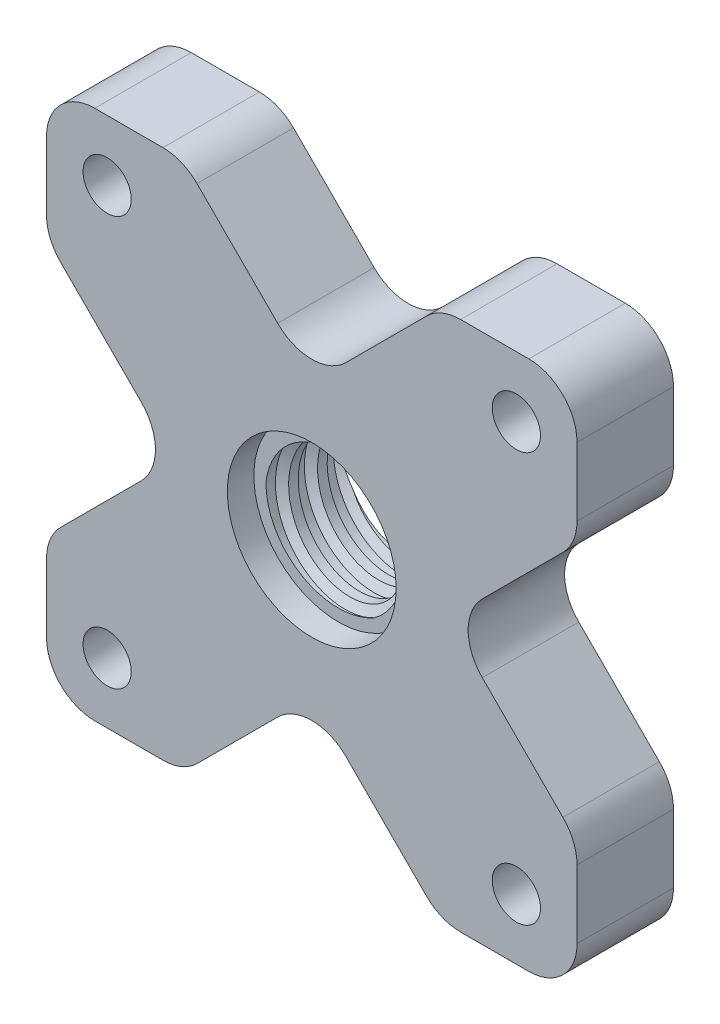
from build123d import *

# Parameters (mm, degrees)
SKETCH2_R           = 2.5
SKETCH2_R_2         = 6.634
BOSS_EXTRUDE1_DEPTH = 10
CUT_SWEEP4_PITCH    = 3
SKETCH6_R           = 8.75
CUT_EXTRUDE2_DEPTH  = 2.75


with BuildPart() as part:
    # Sketch2 → Boss-Extrude1 (new body)
    with BuildSketch(Plane.XY):
        with BuildLine():
            Line((15.428932188, 27.5), (22.5, 27.5))
            ThreePointArc((22.5, 27.5), (26.035533906, 26.035533906), (27.5, 22.5))
            Line((27.5, 22.5), (27.5, 15.428932188))
            ThreePointArc((27.5, 15.428932188), (27.119397663, 13.515515026), (26.035533906, 11.893398282))
            Line((26.035533906, 11.893398282), (17.67766953, 3.535533906))
            ThreePointArc((17.67766953, 3.535533906), (16.213203436, 0), (17.67766953, -3.535533906))
            Line((17.67766953, -3.535533906), (26.035533906, -11.893398282))
            ThreePointArc((26.035533906, -11.893398282), (27.119397663, -13.515515026), (27.5, -15.428932188))
            Line((27.5, -15.428932188), (27.5, -22.5))
            ThreePointArc((27.5, -22.5), (26.035533906, -26.035533906), (22.5, -27.5))
            Line((22.5, -27.5), (15.428932188, -27.5))
            ThreePointArc((15.428932188, -27.5), (13.515515026, -27.119397663), (11.893398282, -26.035533906))
            Line((11.893398282, -26.035533906), (3.535533906, -17.67766953))
            ThreePointArc((3.535533906, -17.67766953), (0, -16.213203436), (-3.535533906, -17.67766953))
            Line((-3.535533906, -17.67766953), (-11.893398282, -26.035533906))
            ThreePointArc((-11.893398282, -26.035533906), (-13.515515026, -27.119397663), (-15.428932188, -27.5))
            Line((-15.428932188, -27.5), (-22.5, -27.5))
            ThreePointArc((-22.5, -27.5), (-26.035533906, -26.035533906), (-27.5, -22.5))
            Line((-27.5, -22.5), (-27.5, -15.428932188))
            ThreePointArc((-27.5, -15.428932188), (-27.119397663, -13.515515026), (-26.035533906, -11.893398282))
            Line((-26.035533906, -11.893398282), (-17.67766953, -3.535533906))
            ThreePointArc((-17.67766953, -3.535533906), (-16.213203436, 0), (-17.67766953, 3.535533906))
            Line((-17.67766953, 3.535533906), (-26.035533906, 11.893398282))
            ThreePointArc((-26.035533906, 11.893398282), (-27.119397663, 13.515515026), (-27.5, 15.428932188))
            Line((-27.5, 15.428932188), (-27.5, 22.5))
            ThreePointArc((-27.5, 22.5), (-26.035533906, 26.035533906), (-22.5, 27.5))
            Line((-22.5, 27.5), (-15.428932188, 27.5))
            ThreePointArc((-15.428932188, 27.5), (-13.515515026, 27.119397663), (-11.893398282, 26.035533906))
            Line((-11.893398282, 26.035533906), (-3.535533906, 17.67766953))
            ThreePointArc((-3.535533906, 17.67766953), (0, 16.213203436), (3.535533906, 17.67766953))
            Line((3.535533906, 17.67766953), (11.893398282, 26.035533906))
            ThreePointArc((11.893398282, 26.035533906), (13.515515026, 27.119397663), (15.428932188, 27.5))
        make_face()
        with Locations((-21.213203436, 21.213203436)):
            Circle(SKETCH2_R, mode=Mode.SUBTRACT)
        Circle(SKETCH2_R_2, mode=Mode.SUBTRACT)
        with Locations((21.213203436, 21.213203436)):
            Circle(SKETCH2_R, mode=Mode.SUBTRACT)
        with Locations((21.213203436, -21.213203436)):
            Circle(SKETCH2_R, mode=Mode.SUBTRACT)
        with Locations((-21.213203436, -21.213203436)):
            Circle(SKETCH2_R, mode=Mode.SUBTRACT)
    extrude(amount=BOSS_EXTRUDE1_DEPTH)

    # Cut-Sweep4: arcs per turn and ends read off the stored shape
    # Cut-Sweep4: the profile of Sketch4 profile screwed along a right-hand helix through 3.75 turns, 10 arcs to a turn; built about Z, then put on its axis
    cut_sweep4_z = Axis((0, 0, 0), (0, 0, 1))
    cut_sweep4_corners = [(7.500025404, 0, -2.5), (7.500025404, 0, -3.5), (6.6337, 0, -4.000173205), (6.6337, 0, -1.999826795)]
    with BuildLine(mode=Mode.PRIVATE) as cut_sweep4_profile:
        Line(cut_sweep4_corners[0], cut_sweep4_corners[1])
        Line(cut_sweep4_corners[1], cut_sweep4_corners[2])
        Line(cut_sweep4_corners[2], cut_sweep4_corners[3])
        Line(cut_sweep4_corners[3], cut_sweep4_corners[0])
    cut_sweep4_cap = Face(cut_sweep4_profile.wire())
    cut_sweep4_turn_angles = [0, 18, 36, 54, 72, 90, 108, 126, 144, 162, 180, 198, 216, 234, 252, 270, 288, 306, 324, 342, 360]
    cut_sweep4_turn_weights = [1, 0.9510565162951535, 1, 0.9510565162951535, 1, 0.9510565162951535, 1, 0.9510565162951535, 1, 0.9510565162951535, 1, 0.9510565162951535, 1, 0.9510565162951535, 1, 0.9510565162951535, 1, 0.9510565162951535, 1, 0.9510565162951535, 1]
    cut_sweep4_turn_rails = [Edge.make_bspline([Vector(p[0], p[1], 0).rotate(cut_sweep4_z, cut_sweep4_turn_angles[k]) / cut_sweep4_turn_weights[k] + Vector(0, 0, p[2] + CUT_SWEEP4_PITCH * cut_sweep4_turn_angles[k] / 360) for k in range(21)], [0, 0, 0, 1, 1, 2, 2, 3, 3, 4, 4, 5, 5, 6, 6, 7, 7, 8, 8, 9, 9, 10, 10, 10], 2, cut_sweep4_turn_weights) for p in cut_sweep4_corners]
    cut_sweep4_turn_sides = [Face.make_surface_from_curves(cut_sweep4_turn_rails[p[0]], cut_sweep4_turn_rails[p[1]]) for p in [(0, 1), (1, 2), (2, 3), (3, 0)]]
    cut_sweep4_last_angles = [1080, 1098, 1116, 1134, 1152, 1170, 1188, 1206, 1224, 1242, 1260, 1278, 1296, 1314, 1332, 1341, 1350]
    cut_sweep4_last_weights = [1, 0.9510565162951535, 1, 0.9510565162951535, 1, 0.9510565162951535, 1, 0.9510565162951535, 1, 0.9510565162951535, 1, 0.9510565162951535, 1, 0.9510565162951535, 1, 0.9876883405951378, 1]
    cut_sweep4_last_rails = [Edge.make_bspline([Vector(p[0], p[1], 0).rotate(cut_sweep4_z, cut_sweep4_last_angles[k]) / cut_sweep4_last_weights[k] + Vector(0, 0, p[2] + CUT_SWEEP4_PITCH * cut_sweep4_last_angles[k] / 360) for k in range(17)], [0, 0, 0, 1, 1, 2, 2, 3, 3, 4, 4, 5, 5, 6, 6, 7, 7, 8, 8, 8], 2, cut_sweep4_last_weights) for p in cut_sweep4_corners]
    cut_sweep4_last_sides = [Face.make_surface_from_curves(cut_sweep4_last_rails[p[0]], cut_sweep4_last_rails[p[1]]) for p in [(0, 1), (1, 2), (2, 3), (3, 0)]]
    cut_sweep4 = Plane(origin=(0, 0, 0), x_dir=(0, 1, 0), z_dir=(0, 0, 1)) * Solid(Shell([*[p.moved(Location((0, 0, CUT_SWEEP4_PITCH * i))) for i in range(3) for p in cut_sweep4_turn_sides], *cut_sweep4_last_sides, cut_sweep4_cap, cut_sweep4_cap.rotate(cut_sweep4_z, 1350).moved(Location((0, 0, CUT_SWEEP4_PITCH * 1350 / 360)))]))
    add(cut_sweep4, mode=Mode.SUBTRACT)

    # Sketch6 → Cut-Extrude2 (cut)
    with BuildSketch(Plane.XY.offset(10)):
        Circle(SKETCH6_R)
    extrude(amount=-CUT_EXTRUDE2_DEPTH, mode=Mode.SUBTRACT)


solid = part.part
